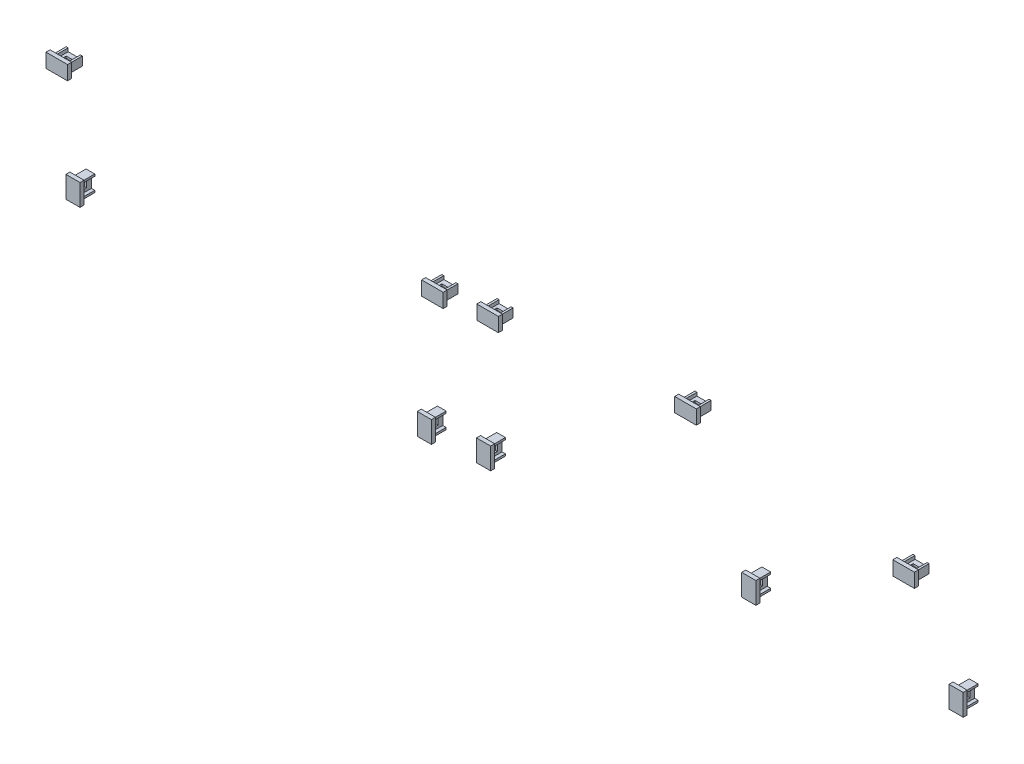
from build123d import *

# Parameters (mm, degrees)
SKETCH2_W                = 12
SKETCH2_H                = 6.5
BOSS_EXTRUDE6_DEPTH      = 10
EXTRUDE_THIN9_OUTLINE_W  = 16
EXTRUDE_THIN9_OUTLINE_H  = 10.5
EXTRUDE_THIN9_DEPTH      = 3
SKETCH15_W               = 9
SKETCH15_H               = 2.5
CUT_EXTRUDE1_DEPTH       = 10
CUT_EXTRUDE3_DEPTH       = 49.877397639
CUT_EXTRUDE3_DEPTH_BACK  = 49.877397639
SKETCH17_W               = 5
SKETCH17_H               = 5
SKETCH3_W                = 6.5
SKETCH3_H                = 12
BOSS_EXTRUDE3_DEPTH      = 10
EXTRUDE_THIN3_OUTLINE_W  = 10.5
EXTRUDE_THIN3_OUTLINE_H  = 16
EXTRUDE_THIN3_DEPTH      = 3
SKETCH18_W               = 2.5
SKETCH18_H               = 9
CUT_EXTRUDE4_DEPTH       = 10
CUT_EXTRUDE5_DEPTH       = 104.007584672
CUT_EXTRUDE5_DEPTH_BACK  = 104.007584672
SKETCH19_W               = 5
SKETCH19_H               = 5
SKETCH4_W                = 6.5
SKETCH4_H                = 12
BOSS_EXTRUDE5_DEPTH      = 10
EXTRUDE_THIN4_OUTLINE_W  = 10.5
EXTRUDE_THIN4_OUTLINE_H  = 16
EXTRUDE_THIN4_DEPTH      = 3
SKETCH20_W               = 2.5
SKETCH20_H               = 9
CUT_EXTRUDE6_DEPTH       = 10
SKETCH21_W               = 5
SKETCH21_H               = 5
CUT_EXTRUDE7_DEPTH       = 10
SKETCH5_W                = 12
SKETCH5_H                = 6.5
BOSS_EXTRUDE2_DEPTH      = 10
EXTRUDE_THIN1_OUTLINE_W  = 16
EXTRUDE_THIN1_OUTLINE_H  = 10.5
EXTRUDE_THIN1_DEPTH      = 3
SKETCH22_W               = 9
SKETCH22_H               = 2.5
CUT_EXTRUDE8_DEPTH       = 10
CUT_EXTRUDE9_DEPTH       = 309.354605122
CUT_EXTRUDE9_DEPTH_BACK  = 309.354605122
SKETCH23_W               = 5
SKETCH23_H               = 5
SKETCH6_W                = 6.5
SKETCH6_H                = 12
BOSS_EXTRUDE1_DEPTH      = 10
EXTRUDE_THIN2_OUTLINE_W  = 10.5
EXTRUDE_THIN2_OUTLINE_H  = 16
EXTRUDE_THIN2_DEPTH      = 3
SKETCH24_W               = 2.5
SKETCH24_H               = 9
CUT_EXTRUDE10_DEPTH      = 10
CUT_EXTRUDE11_DEPTH      = 343.766046306
CUT_EXTRUDE11_DEPTH_BACK = 343.766046306
SKETCH25_W               = 5
SKETCH25_H               = 5
SKETCH7_W                = 12
SKETCH7_H                = 6.5
BOSS_EXTRUDE7_DEPTH      = 10
EXTRUDE_THIN8_OUTLINE_W  = 16
EXTRUDE_THIN8_OUTLINE_H  = 10.5
EXTRUDE_THIN8_DEPTH      = 3
SKETCH26_W               = 9
SKETCH26_H               = 2.5
CUT_EXTRUDE12_DEPTH      = 10
CUT_EXTRUDE13_DEPTH      = 313.085825535
CUT_EXTRUDE13_DEPTH_BACK = 313.085825535
SKETCH27_W               = 5
SKETCH27_H               = 5
SKETCH8_W                = 12
SKETCH8_H                = 6.5
BOSS_EXTRUDE9_DEPTH      = 10
EXTRUDE_THIN7_OUTLINE_W  = 16
EXTRUDE_THIN7_OUTLINE_H  = 10.5
EXTRUDE_THIN7_DEPTH      = 3
SKETCH28_W               = 9
SKETCH28_H               = 2.5
CUT_EXTRUDE14_DEPTH      = 10
CUT_EXTRUDE15_DEPTH      = 362.192555986
CUT_EXTRUDE15_DEPTH_BACK = 362.192555986
SKETCH29_W               = 5
SKETCH29_H               = 5
SKETCH9_W                = 6.5
SKETCH9_H                = 12
BOSS_EXTRUDE10_DEPTH     = 10
EXTRUDE_THIN6_OUTLINE_W  = 10.5
EXTRUDE_THIN6_OUTLINE_H  = 16
EXTRUDE_THIN6_DEPTH      = 3
SKETCH30_W               = 2.5
SKETCH30_H               = 9
CUT_EXTRUDE16_DEPTH      = 10
SKETCH31_W               = 5
SKETCH31_H               = 5
CUT_EXTRUDE17_DEPTH      = 10
SKETCH10_W               = 6.5
SKETCH10_H               = 12
BOSS_EXTRUDE8_DEPTH      = 10
EXTRUDE_THIN5_OUTLINE_W  = 10.5
EXTRUDE_THIN5_OUTLINE_H  = 16
EXTRUDE_THIN5_DEPTH      = 3
SKETCH32_W               = 2.5
SKETCH32_H               = 9
CUT_EXTRUDE18_DEPTH      = 10
SKETCH34_W               = 5
SKETCH34_H               = 5
CUT_EXTRUDE19_DEPTH      = 10
DRIV_TOP_RIGHT_MASTER_W  = 12
DRIV_TOP_RIGHT_MASTER_H  = 6.5
BOSS_EXTRUDE4_DEPTH      = 10
SKETCH13_W               = 16
SKETCH13_H               = 10.5
SKETCH13_W_2             = 12
SKETCH13_H_2             = 6.5
EXTRUDE_THIN11_DEPTH     = 3
SKETCH13_4_W             = 12
SKETCH13_4_H             = 6.5
BOSS_EXTRUDE11_DEPTH     = 3
SKETCH35_W               = 9
SKETCH35_H               = 2.5
CUT_EXTRUDE20_DEPTH      = 10
SKETCH36_W               = 5
SKETCH36_H               = 5
CUT_EXTRUDE21_DEPTH      = 10


# Read off the part's stored shape, not the designer's step: Extrude-Thin9, Extrude-Thin3, Extrude-Thin4, Extrude-Thin1, Extrude-Thin2, Extrude-Thin8, Extrude-Thin7, Extrude-Thin6, Extrude-Thin5
with BuildPart() as part:
    # Sketch2 → Boss-Extrude6 (new body)
    with BuildSketch(Plane.XY.offset(-2)):
        with Locations((39, 2)):
            Rectangle(SKETCH2_W, SKETCH2_H)
    extrude(amount=-BOSS_EXTRUDE6_DEPTH)

    # Extrude-Thin9 outline → Extrude-Thin9 (add)
    with BuildSketch(Plane.XY.offset(-2)):
        with Locations((39, 2)):
            Rectangle(EXTRUDE_THIN9_OUTLINE_W, EXTRUDE_THIN9_OUTLINE_H)
    extrude(amount=EXTRUDE_THIN9_DEPTH)

    # Sketch15 → Cut-Extrude1 (cut)
    with BuildSketch(Plane(origin=(0, 0, -12), x_dir=(-1, 0, 0), z_dir=(0, 0, -1))):
        with Locations((-39, 4)):
            Rectangle(SKETCH15_W, SKETCH15_H)
        with Locations((-39, 0)):
            Rectangle(SKETCH15_W, SKETCH15_H)
    extrude(amount=-CUT_EXTRUDE1_DEPTH, mode=Mode.SUBTRACT)

    # Sketch17 → Cut-Extrude3 (cut, two sides: drawn at the far end of the back side and taken through both)
    with BuildSketch(Plane(origin=(0, 2.75, 0), x_dir=(1, 0, 0), z_dir=(0, 1, 0)).offset(-CUT_EXTRUDE3_DEPTH_BACK)):
        with Locations((39, 6)):
            Rectangle(SKETCH17_W, SKETCH17_H)
    extrude(amount=CUT_EXTRUDE3_DEPTH + CUT_EXTRUDE3_DEPTH_BACK, mode=Mode.SUBTRACT)


with BuildPart() as body_2:
    # Sketch3 → Boss-Extrude3 (new body)
    with BuildSketch(Plane.XY.offset(7)):
        with Locations((1, -83)):
            Rectangle(SKETCH3_W, SKETCH3_H)
    extrude(amount=-BOSS_EXTRUDE3_DEPTH)

    # Extrude-Thin3 outline → Extrude-Thin3 (add)
    with BuildSketch(Plane.XY.offset(7)):
        with Locations((1, -83)):
            Rectangle(EXTRUDE_THIN3_OUTLINE_W, EXTRUDE_THIN3_OUTLINE_H)
    extrude(amount=EXTRUDE_THIN3_DEPTH)

    # Sketch18 → Cut-Extrude4 (cut)
    with BuildSketch(Plane(origin=(0, 0, -3), x_dir=(-1, 0, 0), z_dir=(0, 0, -1))):
        with Locations((-3, -83)):
            Rectangle(SKETCH18_W, SKETCH18_H)
        with Locations((1, -83)):
            Rectangle(SKETCH18_W, SKETCH18_H)
    extrude(amount=-CUT_EXTRUDE4_DEPTH, mode=Mode.SUBTRACT)

    # Sketch19 → Cut-Extrude5 (cut, two sides: drawn at the far end of the back side and taken through both)
    with BuildSketch(Plane.ZY.offset(-0.25).offset(-CUT_EXTRUDE5_DEPTH_BACK)):
        with Locations((3, -83)):
            Rectangle(SKETCH19_W, SKETCH19_H)
    extrude(amount=CUT_EXTRUDE5_DEPTH + CUT_EXTRUDE5_DEPTH_BACK, mode=Mode.SUBTRACT)


with BuildPart() as body_3:
    # Sketch4 → Boss-Extrude5 (new body)
    with BuildSketch(Plane.XY.offset(-1)):
        with Locations((37, -86)):
            Rectangle(SKETCH4_W, SKETCH4_H)
    extrude(amount=-BOSS_EXTRUDE5_DEPTH)

    # Extrude-Thin4 outline → Extrude-Thin4 (add)
    with BuildSketch(Plane.XY.offset(-1)):
        with Locations((37, -86)):
            Rectangle(EXTRUDE_THIN4_OUTLINE_W, EXTRUDE_THIN4_OUTLINE_H)
    extrude(amount=EXTRUDE_THIN4_DEPTH)

    # Sketch20 → Cut-Extrude6 (cut)
    with BuildSketch(Plane(origin=(0, 0, -11), x_dir=(-1, 0, 0), z_dir=(0, 0, -1))):
        with Locations((-39, -86)):
            Rectangle(SKETCH20_W, SKETCH20_H)
        with Locations((-35, -86)):
            Rectangle(SKETCH20_W, SKETCH20_H)
    extrude(amount=-CUT_EXTRUDE6_DEPTH, mode=Mode.SUBTRACT)

    # Sketch21 → Cut-Extrude7 (cut)
    with BuildSketch(Plane.ZY.offset(-36.25)):
        with Locations((-5, -86)):
            Rectangle(SKETCH21_W, SKETCH21_H)
    extrude(amount=-CUT_EXTRUDE7_DEPTH, mode=Mode.SUBTRACT)


with BuildPart() as body_4:
    # Sketch5 → Boss-Extrude2 (new body)
    with BuildSketch(Plane.XY.offset(-6)):
        with Locations((-285, 0)):
            Rectangle(SKETCH5_W, SKETCH5_H)
    extrude(amount=-BOSS_EXTRUDE2_DEPTH)

    # Extrude-Thin1 outline → Extrude-Thin1 (add)
    with BuildSketch(Plane.XY.offset(-6)):
        with Locations((-285, 0)):
            Rectangle(EXTRUDE_THIN1_OUTLINE_W, EXTRUDE_THIN1_OUTLINE_H)
    extrude(amount=EXTRUDE_THIN1_DEPTH)

    # Sketch22 → Cut-Extrude8 (cut)
    with BuildSketch(Plane(origin=(0, 0, -16), x_dir=(-1, 0, 0), z_dir=(0, 0, -1))):
        with Locations((285, 2)):
            Rectangle(SKETCH22_W, SKETCH22_H)
        with Locations((285, -2)):
            Rectangle(SKETCH22_W, SKETCH22_H)
    extrude(amount=-CUT_EXTRUDE8_DEPTH, mode=Mode.SUBTRACT)

    # Sketch23 → Cut-Extrude9 (cut, two sides: drawn at the far end of the back side and taken through both)
    with BuildSketch(Plane(origin=(0, 0.75, 0), x_dir=(1, 0, 0), z_dir=(0, 1, 0)).offset(-CUT_EXTRUDE9_DEPTH_BACK)):
        with Locations((-285, 10)):
            Rectangle(SKETCH23_W, SKETCH23_H)
    extrude(amount=CUT_EXTRUDE9_DEPTH + CUT_EXTRUDE9_DEPTH_BACK, mode=Mode.SUBTRACT)


with BuildPart() as body_5:
    # Sketch6 → Boss-Extrude1 (new body)
    with BuildSketch(Plane.XY.offset(-14)):
        with Locations((-281, -82)):
            Rectangle(SKETCH6_W, SKETCH6_H)
    extrude(amount=-BOSS_EXTRUDE1_DEPTH)

    # Extrude-Thin2 outline → Extrude-Thin2 (add)
    with BuildSketch(Plane.XY.offset(-14)):
        with Locations((-281, -82)):
            Rectangle(EXTRUDE_THIN2_OUTLINE_W, EXTRUDE_THIN2_OUTLINE_H)
    extrude(amount=EXTRUDE_THIN2_DEPTH)

    # Sketch24 → Cut-Extrude10 (cut)
    with BuildSketch(Plane(origin=(0, 0, -24), x_dir=(-1, 0, 0), z_dir=(0, 0, -1))):
        with Locations((279, -82)):
            Rectangle(SKETCH24_W, SKETCH24_H)
        with Locations((283, -82)):
            Rectangle(SKETCH24_W, SKETCH24_H)
    extrude(amount=-CUT_EXTRUDE10_DEPTH, mode=Mode.SUBTRACT)

    # Sketch25 → Cut-Extrude11 (cut, two sides: drawn at the far end of the back side and taken through both)
    with BuildSketch(Plane.ZY.offset(281.75).offset(-CUT_EXTRUDE11_DEPTH_BACK)):
        with Locations((-18, -82)):
            Rectangle(SKETCH25_W, SKETCH25_H)
    extrude(amount=CUT_EXTRUDE11_DEPTH + CUT_EXTRUDE11_DEPTH_BACK, mode=Mode.SUBTRACT)


with BuildPart() as body_6:
    # Sketch7 → Boss-Extrude7 (new body)
    with BuildSketch(Plane.XY.offset(-8)):
        with Locations((180, 10)):
            Rectangle(SKETCH7_W, SKETCH7_H)
    extrude(amount=-BOSS_EXTRUDE7_DEPTH)

    # Extrude-Thin8 outline → Extrude-Thin8 (add)
    with BuildSketch(Plane.XY.offset(-8)):
        with Locations((180, 10)):
            Rectangle(EXTRUDE_THIN8_OUTLINE_W, EXTRUDE_THIN8_OUTLINE_H)
    extrude(amount=EXTRUDE_THIN8_DEPTH)

    # Sketch26 → Cut-Extrude12 (cut)
    with BuildSketch(Plane(origin=(0, 0, -18), x_dir=(-1, 0, 0), z_dir=(0, 0, -1))):
        with Locations((-180, 12)):
            Rectangle(SKETCH26_W, SKETCH26_H)
        with Locations((-180, 8)):
            Rectangle(SKETCH26_W, SKETCH26_H)
    extrude(amount=-CUT_EXTRUDE12_DEPTH, mode=Mode.SUBTRACT)

    # Sketch27 → Cut-Extrude13 (cut, two sides: drawn at the far end of the back side and taken through both)
    with BuildSketch(Plane(origin=(0, 10.75, 0), x_dir=(1, 0, 0), z_dir=(0, 1, 0)).offset(-CUT_EXTRUDE13_DEPTH_BACK)):
        with Locations((180, 12)):
            Rectangle(SKETCH27_W, SKETCH27_H)
    extrude(amount=CUT_EXTRUDE13_DEPTH + CUT_EXTRUDE13_DEPTH_BACK, mode=Mode.SUBTRACT)


with BuildPart() as body_7:
    # Sketch8 → Boss-Extrude9 (new body)
    with BuildSketch(Plane.XY.offset(-7)):
        with Locations((343, -13)):
            Rectangle(SKETCH8_W, SKETCH8_H)
    extrude(amount=-BOSS_EXTRUDE9_DEPTH)

    # Extrude-Thin7 outline → Extrude-Thin7 (add)
    with BuildSketch(Plane.XY.offset(-7)):
        with Locations((343, -13)):
            Rectangle(EXTRUDE_THIN7_OUTLINE_W, EXTRUDE_THIN7_OUTLINE_H)
    extrude(amount=EXTRUDE_THIN7_DEPTH)

    # Sketch28 → Cut-Extrude14 (cut)
    with BuildSketch(Plane(origin=(0, 0, -17), x_dir=(-1, 0, 0), z_dir=(0, 0, -1))):
        with Locations((-343, -11)):
            Rectangle(SKETCH28_W, SKETCH28_H)
        with Locations((-343, -15)):
            Rectangle(SKETCH28_W, SKETCH28_H)
    extrude(amount=-CUT_EXTRUDE14_DEPTH, mode=Mode.SUBTRACT)

    # Sketch29 → Cut-Extrude15 (cut, two sides: drawn at the far end of the back side and taken through both)
    with BuildSketch(Plane(origin=(0, -12.25, 0), x_dir=(1, 0, 0), z_dir=(0, 1, 0)).offset(-CUT_EXTRUDE15_DEPTH_BACK)):
        with Locations((343, 11)):
            Rectangle(SKETCH29_W, SKETCH29_H)
    extrude(amount=CUT_EXTRUDE15_DEPTH + CUT_EXTRUDE15_DEPTH_BACK, mode=Mode.SUBTRACT)


with BuildPart() as body_8:
    # Sketch9 → Boss-Extrude10 (new body)
    with BuildSketch(Plane.XY.offset(-7)):
        with Locations((382, -75)):
            Rectangle(SKETCH9_W, SKETCH9_H)
    extrude(amount=-BOSS_EXTRUDE10_DEPTH)

    # Extrude-Thin6 outline → Extrude-Thin6 (add)
    with BuildSketch(Plane.XY.offset(-7)):
        with Locations((382, -75)):
            Rectangle(EXTRUDE_THIN6_OUTLINE_W, EXTRUDE_THIN6_OUTLINE_H)
    extrude(amount=EXTRUDE_THIN6_DEPTH)

    # Sketch30 → Cut-Extrude16 (cut)
    with BuildSketch(Plane(origin=(0, 0, -17), x_dir=(-1, 0, 0), z_dir=(0, 0, -1))):
        with Locations((-384, -75)):
            Rectangle(SKETCH30_W, SKETCH30_H)
        with Locations((-380, -75)):
            Rectangle(SKETCH30_W, SKETCH30_H)
    extrude(amount=-CUT_EXTRUDE16_DEPTH, mode=Mode.SUBTRACT)

    # Sketch31 → Cut-Extrude17 (cut)
    with BuildSketch(Plane.ZY.offset(-381.25)):
        with Locations((-11, -75)):
            Rectangle(SKETCH31_W, SKETCH31_H)
    extrude(amount=-CUT_EXTRUDE17_DEPTH, mode=Mode.SUBTRACT)


with BuildPart() as body_9:
    # Sketch10 → Boss-Extrude8 (new body)
    with BuildSketch(Plane.XY.offset(-11)):
        with Locations((224, -84)):
            Rectangle(SKETCH10_W, SKETCH10_H)
    extrude(amount=-BOSS_EXTRUDE8_DEPTH)

    # Extrude-Thin5 outline → Extrude-Thin5 (add)
    with BuildSketch(Plane.XY.offset(-11)):
        with Locations((224, -84)):
            Rectangle(EXTRUDE_THIN5_OUTLINE_W, EXTRUDE_THIN5_OUTLINE_H)
    extrude(amount=EXTRUDE_THIN5_DEPTH)

    # Sketch32 → Cut-Extrude18 (cut)
    with BuildSketch(Plane(origin=(0, 0, -21), x_dir=(-1, 0, 0), z_dir=(0, 0, -1))):
        with Locations((-226, -84)):
            Rectangle(SKETCH32_W, SKETCH32_H)
        with Locations((-222, -84)):
            Rectangle(SKETCH32_W, SKETCH32_H)
    extrude(amount=-CUT_EXTRUDE18_DEPTH, mode=Mode.SUBTRACT)

    # Sketch34 → Cut-Extrude19 (cut)
    with BuildSketch(Plane.ZY.offset(-223.25)):
        with Locations((-15, -84)):
            Rectangle(SKETCH34_W, SKETCH34_H)
    extrude(amount=-CUT_EXTRUDE19_DEPTH, mode=Mode.SUBTRACT)


with BuildPart() as body_10:
    # DRIV_TOP_RIGHT - MASTER → Boss-Extrude4 (new body)
    with BuildSketch(Plane.XY):
        with Locations((0, -1)):
            Rectangle(DRIV_TOP_RIGHT_MASTER_W, DRIV_TOP_RIGHT_MASTER_H)
    extrude(amount=-BOSS_EXTRUDE4_DEPTH)



with BuildPart() as body_11:
    # Sketch13 → Extrude-Thin11 (new body)
    with BuildSketch(Plane.XY):
        with Locations((0, -1)):
            Rectangle(SKETCH13_W, SKETCH13_H)
        with Locations((0, -1)):
            Rectangle(SKETCH13_W_2, SKETCH13_H_2, mode=Mode.SUBTRACT)
    extrude(amount=EXTRUDE_THIN11_DEPTH)


with BuildPart() as body_10_1:
    add(body_10.part)

    add(body_11.part)  # Boss-Extrude11 merges body 11
    # Sketch13<4> → Boss-Extrude11 (add)
    with BuildSketch(Plane.XY):
        with Locations((0, -1)):
            Rectangle(SKETCH13_4_W, SKETCH13_4_H)
    extrude(amount=BOSS_EXTRUDE11_DEPTH)

    # Sketch35 → Cut-Extrude20 (cut)
    with BuildSketch(Plane(origin=(0, 0, -10), x_dir=(-1, 0, 0), z_dir=(0, 0, -1))):
        with Locations((0, 1)):
            Rectangle(SKETCH35_W, SKETCH35_H)
        with Locations((0, -3)):
            Rectangle(SKETCH35_W, SKETCH35_H)
    extrude(amount=-CUT_EXTRUDE20_DEPTH, mode=Mode.SUBTRACT)

    # Sketch36 → Cut-Extrude21 (cut)
    with BuildSketch(Plane(origin=(0, -0.25, 0), x_dir=(1, 0, 0), z_dir=(0, 1, 0))):
        with Locations((0, 4)):
            Rectangle(SKETCH36_W, SKETCH36_H)
    extrude(amount=-CUT_EXTRUDE21_DEPTH, mode=Mode.SUBTRACT)


solid = Compound([part.part, body_2.part, body_3.part, body_4.part, body_5.part, body_6.part, body_7.part, body_8.part, body_9.part, body_10_1.part])
